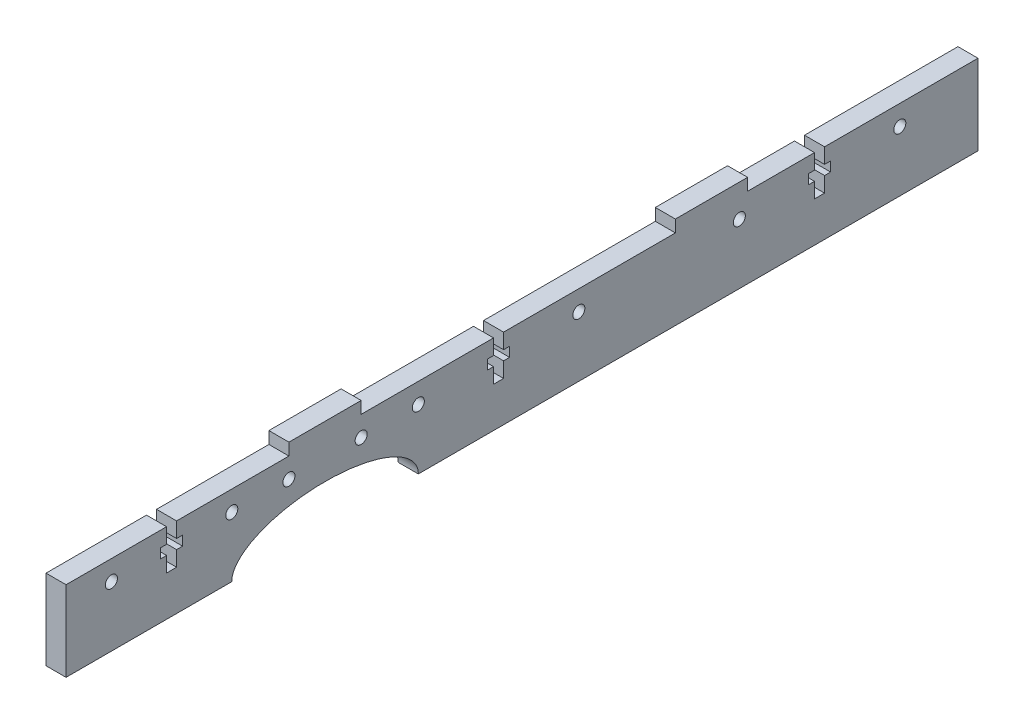
from build123d import *

# Parameters (mm, degrees)
ESTRUSIONE_ESTRUSIONE1_DEPTH = 5
SCHIZZO3_R                   = 1.5
SCHIZZO3_RX                  = 23.25
SCHIZZO3_RY                  = 10
TAGLIO_ESTRUSIONE1_DEPTH     = 115.495353727
TAGLIO_ESTRUSIONE2_DEPTH     = 115.495353842
SCHIZZO6_W                   = 5
SCHIZZO6_H                   = 18
ESTRUSIONE_ESTRUSIONE2_DEPTH = 3


with BuildPart() as part:
    # Schizzo1 → Estrusione-Estrusione1 (new body)
    with BuildSketch(Plane(origin=(0, 0, 0), x_dir=(0, 0, -1), z_dir=(1, 0, 0))):
        Polygon((-113.645, -10), (113.645, -10), (113.645, 10), (-40.095, 10), (-40.095, 13), (-58.095, 13), (-58.095, 10), (-113.645, 10), align=None)
    extrude(amount=ESTRUSIONE_ESTRUSIONE1_DEPTH)

    # Schizzo3 → Taglio-Estrusione1 (cut, through all)
    with BuildSketch(Plane(origin=(0, 0, 0), x_dir=(0, 0, -1), z_dir=(1, 0, 0))):
        with Locations((-58.095, 5)):
            Circle(SCHIZZO3_R)
        with Locations((-72.345, 5)):
            Circle(SCHIZZO3_R)
        with Locations((-40.095, 5)):
            Circle(SCHIZZO3_R)
        with Locations((-25.845, 5)):
            Circle(SCHIZZO3_R)
        with Locations((14.155, 5)):
            Circle(SCHIZZO3_R)
        with Locations((54.155, 5)):
            Circle(SCHIZZO3_R)
        with Locations((94.155, 5)):
            Circle(SCHIZZO3_R)
        with Locations((-102.345, 5)):
            Circle(SCHIZZO3_R)
        with Locations(Location((-49.095, -10), (0, 0, 0))):
            Ellipse(SCHIZZO3_RX, SCHIZZO3_RY)
    extrude(amount=TAGLIO_ESTRUSIONE1_DEPTH, mode=Mode.SUBTRACT)

    # Schizzo5 → Taglio-Estrusione2 (cut, through all)
    with BuildSketch(Plane(origin=(0, 0, 0), x_dir=(0, 0, -1), z_dir=(1, 0, 0))):
        Polygon((-88.595, 0), (-88.595, 3.8), (-90.095, 3.8), (-90.095, 6.2), (-88.595, 6.2), (-88.595, 10), (-86.095, 10), (-86.095, 6.2), (-84.595, 6.2), (-84.595, 3.8), (-86.095, 3.8), (-86.095, 0), align=None)
        Polygon((-7.095, 0), (-7.095, 3.8), (-8.595, 3.8), (-8.595, 6.2), (-7.095, 6.2), (-7.095, 10), (-4.595, 10), (-4.595, 6.2), (-3.095, 6.2), (-3.095, 3.8), (-4.595, 3.8), (-4.595, 0), align=None)
        Polygon((72.905, 0), (72.905, 3.8), (71.405, 3.8), (71.405, 6.2), (72.905, 6.2), (72.905, 10), (75.405, 10), (75.405, 6.2), (76.905, 6.2), (76.905, 3.8), (75.405, 3.8), (75.405, 0), align=None)
    extrude(amount=TAGLIO_ESTRUSIONE2_DEPTH, mode=Mode.SUBTRACT)

    # Schizzo6 → Estrusione-Estrusione2 (add)
    with BuildSketch(Plane(origin=(0, 10, 0), x_dir=(1, 0, 0), z_dir=(0, 1, 0))):
        with Locations((2.5, 47.225)):
            Rectangle(SCHIZZO6_W, SCHIZZO6_H)
    extrude(amount=ESTRUSIONE_ESTRUSIONE2_DEPTH)


solid = part.part
